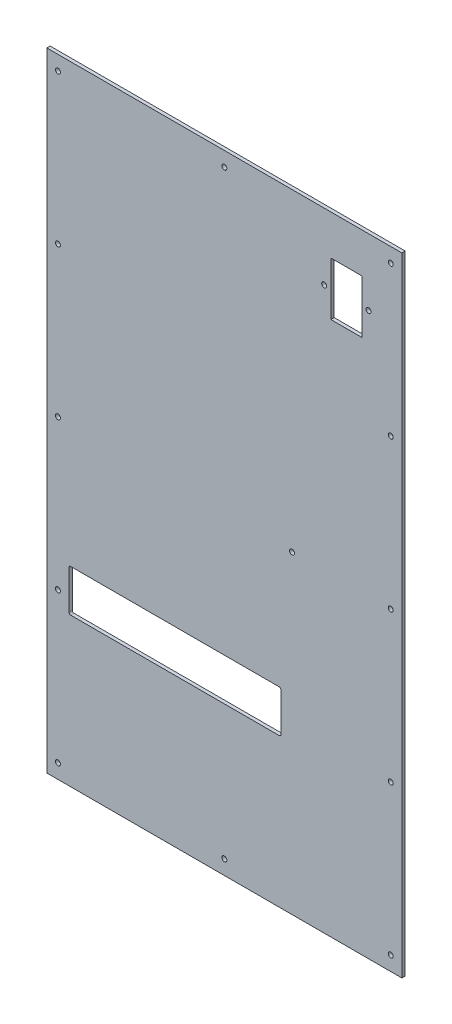
from build123d import *

# Parameters (mm, degrees)
SKETCH_1_W          = 320
SKETCH_1_H          = 566
SKETCH_1_R          = 2.25
EXTRUDE_1_DEPTH     = 3
SKETCH_3_W          = 191
SKETCH_3_H          = 38
CUT_EXTRUDE_2_DEPTH = 651.2038142
SKETCH3_R           = 2.25
CUT_EXTRUDE1_DEPTH  = 651.2038142
SKETCH_4_R          = 2.25
SKETCH_4_W          = 28
SKETCH_4_H          = 48
CUT_EXTRUDE_3_DEPTH = 651.2038142
FILLET_1_R          = 1.5


with BuildPart() as part:
    # Эскиз1 → Бобышка-Вытянуть1 (new body)
    with BuildSketch(Plane.XY):
        with Locations((160, 283)):
            Rectangle(SKETCH_1_W, SKETCH_1_H)
        with Locations((10, 553)):
            Circle(SKETCH_1_R, mode=Mode.SUBTRACT)
        with Locations((10, 418)):
            Circle(SKETCH_1_R, mode=Mode.SUBTRACT)
        with Locations((10, 283)):
            Circle(SKETCH_1_R, mode=Mode.SUBTRACT)
        with Locations((10, 148)):
            Circle(SKETCH_1_R, mode=Mode.SUBTRACT)
        with Locations((10, 13)):
            Circle(SKETCH_1_R, mode=Mode.SUBTRACT)
        with Locations((310, 13)):
            Circle(SKETCH_1_R, mode=Mode.SUBTRACT)
        with Locations((160, 553)):
            Circle(SKETCH_1_R, mode=Mode.SUBTRACT)
        with Locations((310, 553)):
            Circle(SKETCH_1_R, mode=Mode.SUBTRACT)
        with Locations((310, 418)):
            Circle(SKETCH_1_R, mode=Mode.SUBTRACT)
        with Locations((310, 283)):
            Circle(SKETCH_1_R, mode=Mode.SUBTRACT)
        with Locations((310, 148)):
            Circle(SKETCH_1_R, mode=Mode.SUBTRACT)
        with Locations((160, 13)):
            Circle(SKETCH_1_R, mode=Mode.SUBTRACT)
    extrude(amount=EXTRUDE_1_DEPTH)

    # Эскиз3 → Вырез-Вытянуть2 (cut, through all)
    with BuildSketch(Plane(origin=(0, 0, 0), x_dir=(-1, 0, 0), z_dir=(0, 0, -1))):
        with Locations((-115.5, 153)):
            Rectangle(SKETCH_3_W, SKETCH_3_H)
    extrude(amount=-CUT_EXTRUDE_2_DEPTH, mode=Mode.SUBTRACT)

    # Sketch3 → Cut-Extrude1 (cut, through all)
    with BuildSketch(Plane(origin=(0, 0, 0), x_dir=(-1, 0, 0), z_dir=(0, 0, -1))):
        with Locations((-101, 163)):
            Circle(SKETCH3_R)
        with Locations((-221, 283)):
            Circle(SKETCH3_R)
    extrude(amount=-CUT_EXTRUDE1_DEPTH, mode=Mode.SUBTRACT)

    # Эскиз4 → Вырез-Вытянуть3 (cut, through all)
    with BuildSketch(Plane.XY.offset(3)):
        with Locations((250, 506)):
            Circle(SKETCH_4_R)
        with Locations((290, 506)):
            Circle(SKETCH_4_R)
        with Locations((270, 506)):
            Rectangle(SKETCH_4_W, SKETCH_4_H)
    extrude(amount=-CUT_EXTRUDE_3_DEPTH, mode=Mode.SUBTRACT)

    # Скругление1
    fillet_1_edges = [part.edges().sort_by_distance(p)[0] for p in [
        (211, 134, 1.5),
        (211, 172, 1.5),
        (20, 134, 1.5),
        (20, 172, 1.5),
    ]]
    fillet(fillet_1_edges, radius=FILLET_1_R)


solid = part.part
